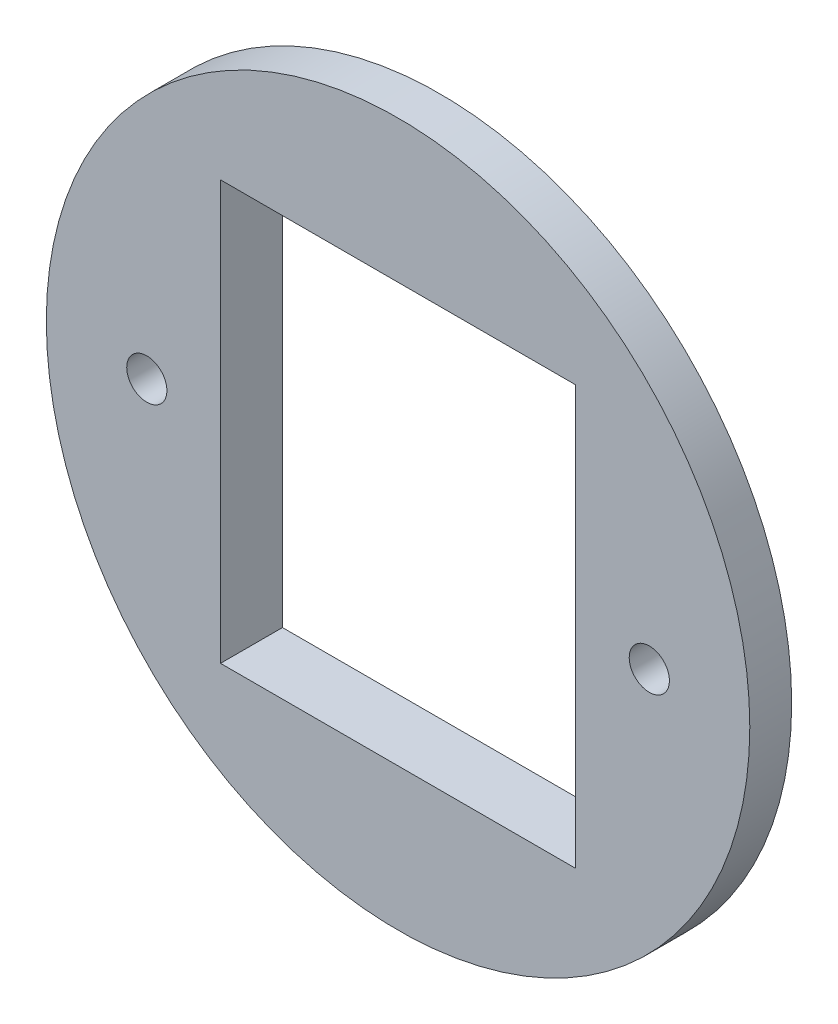
from build123d import *

# Parameters (mm, degrees)
SKETCH1_R           = 26.67
SKETCH1_W           = 26.924
SKETCH1_H           = 31.75
BOSS_EXTRUDE1_DEPTH = 3.175
SKETCH1_4_R         = 21.971
SKETCH1_4_W         = 26.924
SKETCH1_4_H         = 31.75
BOSS_EXTRUDE2_DEPTH = 1.524
SKETCH4_R           = 1.524
CUT_EXTRUDE1_DEPTH  = 39.008662184


with BuildPart() as part:
    # Sketch1 → Boss-Extrude1 (new body)
    with BuildSketch(Plane.XY):
        Circle(SKETCH1_R)
        Rectangle(SKETCH1_W, SKETCH1_H, mode=Mode.SUBTRACT)
    extrude(amount=BOSS_EXTRUDE1_DEPTH)

    # Sketch1<4> → Boss-Extrude2 (add)
    with BuildSketch(Plane.XY):
        Circle(SKETCH1_4_R)
        Rectangle(SKETCH1_4_W, SKETCH1_4_H, mode=Mode.SUBTRACT)
    extrude(amount=-BOSS_EXTRUDE2_DEPTH)

    # Sketch4 → Cut-Extrude1 (cut, through all)
    with BuildSketch(Plane(origin=(0, 0, -1.524), x_dir=(-1, 0, 0), z_dir=(0, 0, -1))):
        with Locations((-19.05, 0)):
            Circle(SKETCH4_R)
        with Locations((19.05, 0)):
            Circle(SKETCH4_R)
    extrude(amount=-CUT_EXTRUDE1_DEPTH, mode=Mode.SUBTRACT)


solid = part.part
